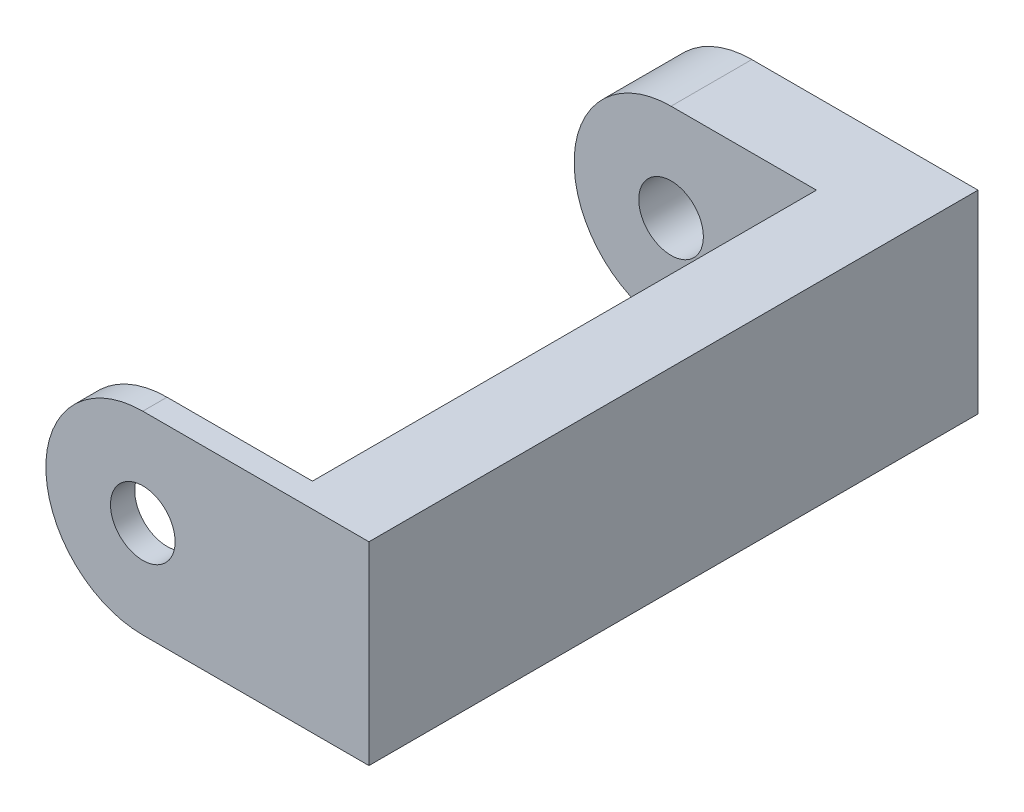
from build123d import *

# Parameters (mm, degrees)
BOSS_EXTRUDE3_DEPTH       = 75.4
SKETCH3_W                 = 40.663621621
SKETCH3_H                 = 62.4
CUT_EXTRUDE1_DEPTH        = 75.4
F_8_0MM_DOWEL_HOLE2_D     = 8
F_8_0MM_DOWEL_HOLE2_DEPTH = 3
F_8_0MM_DOWEL_HOLE2_TIP   = 2.403442476
F_8_0MM_DOWEL_HOLE1_D     = 8


with BuildPart() as part:
    # Sketch2 → Boss-Extrude3 (new body)
    with BuildSketch(Plane.XY):
        with BuildLine():
            ThreePointArc((0, 12), (-12, 0), (0, -12))
            Line((0, -12), (28, -12))
            Line((28, -12), (28, 12))
            Line((28, 12), (0, 12))
        make_face()
    extrude(amount=BOSS_EXTRUDE3_DEPTH)

    # Sketch3 → Cut-Extrude1 (cut)
    with BuildSketch(Plane.XZ.offset(12)):
        with Locations((-2.331810811, 41.2)):
            Rectangle(SKETCH3_W, SKETCH3_H)
    extrude(amount=-CUT_EXTRUDE1_DEPTH, mode=Mode.SUBTRACT)

    # Ø8.0mm Dowel Hole2
    with Locations(Plane.XY.offset(75.4)):
        with Locations((0, 0)):
            Hole(F_8_0MM_DOWEL_HOLE2_D / 2, depth=F_8_0MM_DOWEL_HOLE2_DEPTH)
            with Locations((0, 0, -(F_8_0MM_DOWEL_HOLE2_DEPTH + F_8_0MM_DOWEL_HOLE2_TIP / 2))):  # 118° drill point
                Cone(0, F_8_0MM_DOWEL_HOLE2_D / 2, F_8_0MM_DOWEL_HOLE2_TIP, mode=Mode.SUBTRACT)

    # Ø8.0mm Dowel Hole1 (through all)
    with Locations(Plane.XY.offset(10)):
        with Locations((0, 0)):
            Hole(F_8_0MM_DOWEL_HOLE1_D / 2)


solid = part.part
